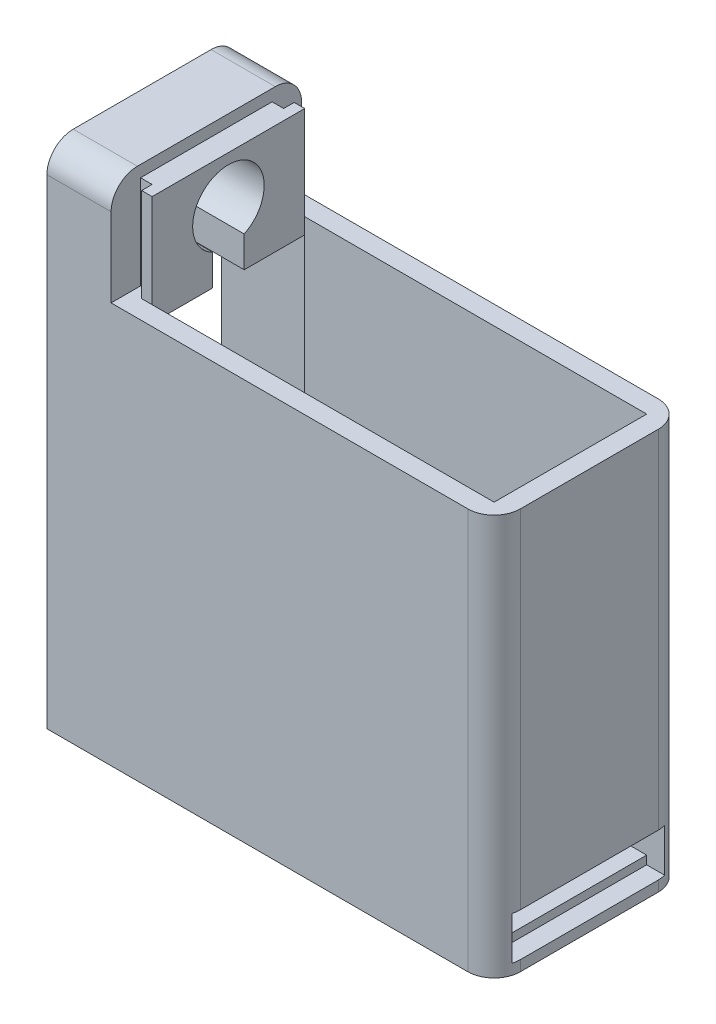
from build123d import *

# Parameters (mm, degrees)
SKETCH_1_W           = 72.2
SKETCH_1_H           = 36.2
SKETCH_1_W_2         = 65
SKETCH_1_H_2         = 29
EXTRUDE_1_DEPTH      = 74.2
SKETCH_2_W           = 72.2
SKETCH_2_H           = 36.2
EXTRUDE_2_DEPTH      = 2
SKETCH_3_W           = 36.2
SKETCH_3_H           = 76.2
SKETCH_3_W_2         = 30.2
SKETCH_3_H_2         = 70.2
EXTRUDE_2_2_DEPTH    = 16.4
SKETCH_4_W           = 30.2
SKETCH_4_H           = 70.2
CUT_EXTRUDE_1_DEPTH  = 16.4
SKETCH_5_W           = 29
SKETCH_5_H           = 4.8
CUT_EXTRUDE_2_DEPTH  = 5
SKETCH_8_W           = 36.2
SKETCH_8_H           = 20
EXTRUDE_3_DEPTH      = 16.4
SKETCH_7_W           = 6
SKETCH_7_H           = 17
CUT_EXTRUDE_3_DEPTH  = 17
SKETCH_9_W           = 6
SKETCH_9_H           = 17
EXTRUDE_4_DEPTH      = 2
SKETCH_10_R          = 7.1
CUT_EXTRUDE_4_DEPTH  = 3
SKETCH_11_W          = 2.2
SKETCH_11_H          = 20
CUT_EXTRUDE_5_DEPTH  = 5.6
SKETCH_12_W          = 2.2
SKETCH_12_H          = 20
CUT_EXTRUDE_6_DEPTH  = 5.6
SKETCH_13_W          = 2
SKETCH_13_H          = 3.6
CUT_EXTRUDE_7_DEPTH  = 20
FILLET_1_R           = 5
FILLET_2_R           = 5
FILLET_3_R           = 5
FILLET_4_R           = 5
SKETCH_14_W          = 4.2
SKETCH_14_H          = 29
CUT_EXTRUDE_8_DEPTH  = 2.2
SKETCH_15_R          = 6.8
CUT_EXTRUDE_9_DEPTH  = 20
SKETCH_16_W          = 6
SKETCH_16_H          = 5.564939783
CUT_EXTRUDE_10_DEPTH = 10
SKETCH_17_W          = 65
SKETCH_17_H          = 29
EXTRUDE_5_DEPTH      = 1.6
SKETCH_18_W          = 3.6
SKETCH_18_H          = 29
CUT_EXTRUDE_11_DEPTH = 3.4
SKETCH_20_W          = 22.2
SKETCH_20_H          = 5
EXTRUDE_6_DEPTH      = 5.4


with BuildPart() as part:
    # 草图1 → 拉伸-薄壁1 (new body)
    with BuildSketch(Plane(origin=(0, 0, 0), x_dir=(1, 0, 0), z_dir=(0, 1, 0))):
        with Locations((32.5, 14.5)):
            Rectangle(SKETCH_1_W, SKETCH_1_H)
        with Locations((32.5, 14.5)):
            Rectangle(SKETCH_1_W_2, SKETCH_1_H_2, mode=Mode.SUBTRACT)
    extrude(amount=EXTRUDE_1_DEPTH)

    # 草图2 → Extrude 2 (add)
    with BuildSketch(Plane(origin=(0, 0, 0), x_dir=(1, 0, 0), z_dir=(0, 1, 0))):
        with Locations((32.5, 14.5)):
            Rectangle(SKETCH_2_W, SKETCH_2_H)
    extrude(amount=-EXTRUDE_2_DEPTH)

    # 草图3 → Extrude 2 2 (add)
    with BuildSketch(Plane(origin=(0, 0, 0), x_dir=(0, 0, -1), z_dir=(1, 0, 0))):
        with Locations((14.5, 36.1)):
            Rectangle(SKETCH_3_W, SKETCH_3_H)
        with Locations((14.5, 36.1)):
            Rectangle(SKETCH_3_W_2, SKETCH_3_H_2, mode=Mode.SUBTRACT)
    extrude(amount=-EXTRUDE_2_2_DEPTH)

    # 草图4 → 切除-拉伸1 (cut)
    with BuildSketch(Plane(origin=(0, 0, 0), x_dir=(0, 0, -1), z_dir=(1, 0, 0))):
        with Locations((14.5, 36.1)):
            Rectangle(SKETCH_4_W, SKETCH_4_H)
    extrude(amount=-CUT_EXTRUDE_1_DEPTH, mode=Mode.SUBTRACT)

    # 草图5 → 切除-拉伸2 (cut)
    with BuildSketch(Plane(origin=(68.6, 0, 0), x_dir=(0, 0, -1), z_dir=(1, 0, 0))):
        with Locations((14.5, 2.4)):
            Rectangle(SKETCH_5_W, SKETCH_5_H)
    extrude(amount=-CUT_EXTRUDE_2_DEPTH, mode=Mode.SUBTRACT)

    # 草图8 → 凸台-拉伸3 (add)
    with BuildSketch(Plane.ZY.offset(16.4)):
        with Locations((-14.5, 84.2)):
            Rectangle(SKETCH_8_W, SKETCH_8_H)
    extrude(amount=-EXTRUDE_3_DEPTH)

    # 草图7 → 切除-拉伸3 (cut)
    with BuildSketch(Plane(origin=(0, 0, 0), x_dir=(0, 0, -1), z_dir=(1, 0, 0))):
        with Locations((14.5, 79.7)):
            Rectangle(SKETCH_7_W, SKETCH_7_H)
    extrude(amount=-CUT_EXTRUDE_3_DEPTH, mode=Mode.SUBTRACT)

    # 草图9 → 凸台-拉伸4 (add)
    with BuildSketch(Plane.ZY.offset(16.4)):
        with Locations((-14.5, 79.7)):
            Rectangle(SKETCH_9_W, SKETCH_9_H)
    extrude(amount=-EXTRUDE_4_DEPTH)

    # 草图10 → 切除-拉伸4 (cut)
    with BuildSketch(Plane.ZY.offset(16.4)):
        with Locations((-14.5, 83.2)):
            Circle(SKETCH_10_R)
    extrude(amount=-CUT_EXTRUDE_4_DEPTH, mode=Mode.SUBTRACT)

    # 草图11 → 切除-拉伸5 (cut)
    with BuildSketch(Plane.XY.offset(3.6)):
        with Locations((-3.1, 84.2)):
            Rectangle(SKETCH_11_W, SKETCH_11_H)
    extrude(amount=-CUT_EXTRUDE_5_DEPTH, mode=Mode.SUBTRACT)

    # 草图12 → 切除-拉伸6 (cut)
    with BuildSketch(Plane(origin=(0, 0, -32.6), x_dir=(-1, 0, 0), z_dir=(0, 0, -1))):
        with Locations((3.1, 84.2)):
            Rectangle(SKETCH_12_W, SKETCH_12_H)
    extrude(amount=-CUT_EXTRUDE_6_DEPTH, mode=Mode.SUBTRACT)

    # 草图13 → 切除-拉伸7 (cut)
    with BuildSketch(Plane(origin=(0, 94.2, 0), x_dir=(1, 0, 0), z_dir=(0, 1, 0))):
        with Locations((-1, 30.8)):
            Rectangle(SKETCH_13_W, SKETCH_13_H)
        with Locations((-1, -1.8)):
            Rectangle(SKETCH_13_W, SKETCH_13_H)
    extrude(amount=-CUT_EXTRUDE_7_DEPTH, mode=Mode.SUBTRACT)

    # 圆角1
    fillet_1_edges = [part.edges().sort_by_distance(p)[0] for p in [
        (-10.3, 94.2, 3.6),
    ]]
    fillet(fillet_1_edges, radius=FILLET_1_R)

    # 圆角2
    fillet_2_edges = [part.edges().sort_by_distance(p)[0] for p in [
        (-10.3, 94.2, -32.6),
    ]]
    fillet(fillet_2_edges, radius=FILLET_2_R)

    # 圆角3
    # the kernel refuses this fillet: 5 mm, written as the material it takes off along each edge
    with BuildSketch(Plane(origin=(68.6, -14.5, 3.6), x_dir=(-1, 0, 0), z_dir=(0, 1, 0))) as fillet_3_piece_1:
        with BuildLine():
            CenterArc((FILLET_3_R, -FILLET_3_R), FILLET_3_R, 90, 90)
            Line((0, -FILLET_3_R), (0, 0))
            Line((0, 0), (FILLET_3_R, 0))
        make_face()
    extrude(amount=101.2, mode=Mode.SUBTRACT)

    # 圆角4
    # the kernel refuses this fillet: 5 mm, written as the material it takes off along each edge
    with BuildSketch(Plane(origin=(68.6, -14.5, -32.6), x_dir=(-1, 0, 0), z_dir=(0, 1, 0))) as fillet_4_piece_1:
        with BuildLine():
            CenterArc((FILLET_4_R, FILLET_4_R), FILLET_4_R, 180, 90)
            Line((0, FILLET_4_R), (0, 0))
            Line((0, 0), (FILLET_4_R, 0))
        make_face()
    extrude(amount=101.2, mode=Mode.SUBTRACT)

    # 草图14 → 切除-拉伸8 (cut)
    with BuildSketch(Plane(origin=(0, 94.2, 0), x_dir=(1, 0, 0), z_dir=(0, 1, 0))):
        with Locations((-2.1, 14.5)):
            Rectangle(SKETCH_14_W, SKETCH_14_H)
    extrude(amount=-CUT_EXTRUDE_8_DEPTH, mode=Mode.SUBTRACT)

    # 草图15 → 切除-拉伸9 (cut)
    with BuildSketch(Plane.ZY.offset(13.4)):
        with Locations((-14.5, 83.2)):
            Circle(SKETCH_15_R)
    extrude(amount=-CUT_EXTRUDE_9_DEPTH, mode=Mode.SUBTRACT)

    # 草图16 → 切除-拉伸10 (cut)
    with BuildSketch(Plane(origin=(-14.4, 0, 0), x_dir=(0, 0, -1), z_dir=(1, 0, 0))):
        with Locations((14.5, 73.982469892)):
            Rectangle(SKETCH_16_W, SKETCH_16_H)
    extrude(amount=-CUT_EXTRUDE_10_DEPTH, mode=Mode.SUBTRACT)

    # 草图17 → 凸台-拉伸5 (add)
    with BuildSketch(Plane(origin=(0, 0, 0), x_dir=(1, 0, 0), z_dir=(0, 1, 0))):
        with Locations((32.5, 14.5)):
            Rectangle(SKETCH_17_W, SKETCH_17_H)
    extrude(amount=EXTRUDE_5_DEPTH)

    # 草图18 → 切除-拉伸11 (cut)
    with BuildSketch(Plane.XZ.offset(-4.8)):
        with Locations((66.8, -14.5)):
            Rectangle(SKETCH_18_W, SKETCH_18_H)
    extrude(amount=-CUT_EXTRUDE_11_DEPTH, mode=Mode.SUBTRACT)

    # 草图20 → 凸台-拉伸6 (add)
    with BuildSketch(Plane(origin=(65, 0, 0), x_dir=(0, 0, -1), z_dir=(1, 0, 0))):
        with Locations((14.5, 9.1)):
            Rectangle(SKETCH_20_W, SKETCH_20_H)
    extrude(amount=-EXTRUDE_6_DEPTH)


solid = part.part
